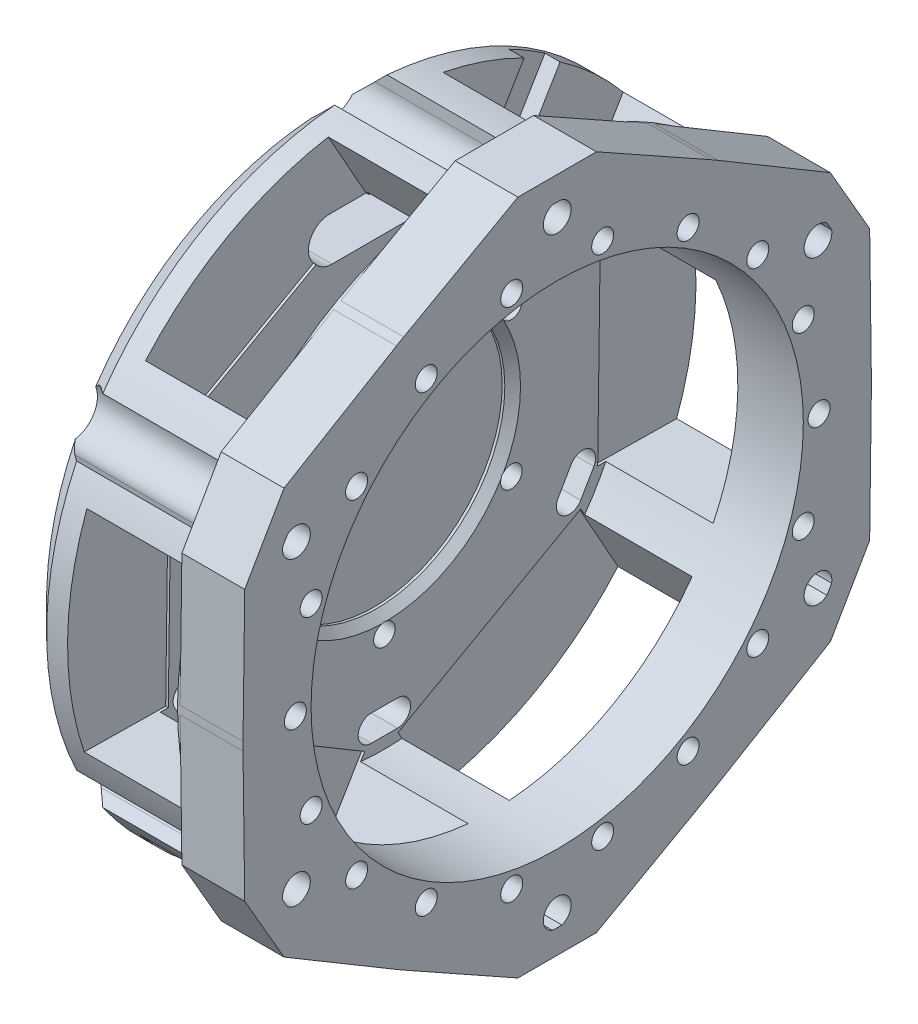
from build123d import *

# Parameters (mm, degrees)
CUT_EXTRUDE1_START      = -10
CUT_EXTRUDE1_OUTLINE_R  = 2.05
CUT_EXTRUDE1_DEPTH      = 10
CUT_EXTRUDE2_START      = -31
CUT_EXTRUDE2_DEPTH      = 31
SKETCH4_R               = 2.65
CUT_EXTRUDE3_DEPTH      = 96.126231924
SKETCH5_R               = 24.5
CUT_EXTRUDE4_DEPTH      = 2
BOSS_EXTRUDE1_DEPTH     = 12
SKETCH7_W               = 21
SKETCH7_H               = 40
CUT_EXTRUDE5_DEPTH      = 19
CIRPATTERN1_COUNT       = 6
CIRPATTERN2_DEPTH       = 10
CHAMFER2_SIZE           = 5.5
CHAMFER3_SIZE           = 1.5
SKETCH11_R              = 2.1
CUT_EXTRUDE7_DEPTH      = 5
SKETCH12_R              = 3.75
CUT_EXTRUDE8_DEPTH      = 5
CUT_EXTRUDE9_DEPTH      = 26
CUT_EXTRUDE9_DEPTH_BACK = 19
SKETCH13_W              = 4
SKETCH13_H              = 8


# Read off the part's stored shape, not the designer's step: Cut-Extrude1, CirPattern2
with BuildPart() as part:
    # Sketch1 → Revolve1 (revolve)
    with BuildSketch(Plane.XY, mode=Mode.PRIVATE) as revolve1_sk:
        Polygon((0, 0), (0, 60), (43, 60), (43, 47), (10, 47), (10, 0), align=None)
    revolve(revolve1_sk.sketch.rotate(Axis((-58.663171691, 0, 0), (1, 0, 0)), 90), axis=Axis((-58.663171691, 0, 0), (1, 0, 0)))

    # Cut-Extrude1 outline → Cut-Extrude1 (cut)
    with BuildSketch(Plane(origin=(10, 0, 0), x_dir=(0, 0, -1), z_dir=(1, 0, 0)).offset(CUT_EXTRUDE1_START)):
        with Locations((0, 28)):
            Circle(CUT_EXTRUDE1_OUTLINE_R)
        with Locations((-24.248711306, 14)):
            Circle(CUT_EXTRUDE1_OUTLINE_R)
        with Locations((-24.248711306, -14)):
            Circle(CUT_EXTRUDE1_OUTLINE_R)
        with Locations((0, -28)):
            Circle(CUT_EXTRUDE1_OUTLINE_R)
        with Locations((24.248711306, -14)):
            Circle(CUT_EXTRUDE1_OUTLINE_R)
        with Locations((24.248711306, 14)):
            Circle(CUT_EXTRUDE1_OUTLINE_R)
        with BuildLine():
            Line((10, 46.25), (-10, 46.25))
            ThreePointArc((-10, 46.25), (-14, 42.25), (-10, 38.25))
            Line((-10, 38.25), (10, 38.25))
            ThreePointArc((10, 38.25), (14, 42.25), (10, 46.25))
        make_face()
    extrude(amount=CUT_EXTRUDE1_DEPTH, mode=Mode.SUBTRACT)

    # Sketch3 → Cut-Extrude2 (cut)
    with BuildSketch(Plane.ZY.offset(CUT_EXTRUDE2_START)):
        with BuildLine():
            Line((-5, 57.5), (-5, 59.791303716))
            ThreePointArc((-5, 59.791303716), (0, 60), (5, 59.791303716))
            Line((5, 59.791303716), (5, 57.5))
            ThreePointArc((5, 57.5), (0, 52.5), (-5, 57.5))
        make_face()
        with BuildLine():
            Line((52.296460718, 24.419872981), (54.280787943, 25.565524839))
            ThreePointArc((54.280787943, 25.565524839), (51.961524227, 30), (49.280787943, 34.225778877))
            Line((49.280787943, 34.225778877), (47.296460718, 33.080127019))
            ThreePointArc((47.296460718, 33.080127019), (45.466333699, 26.25), (52.296460718, 24.419872981))
        make_face()
        with BuildLine():
            Line((47.296460718, -33.080127019), (49.280787943, -34.225778877))
            ThreePointArc((49.280787943, -34.225778877), (51.961524227, -30), (54.280787943, -25.565524839))
            Line((54.280787943, -25.565524839), (52.296460718, -24.419872981))
            ThreePointArc((52.296460718, -24.419872981), (45.466333699, -26.25), (47.296460718, -33.080127019))
        make_face()
        with BuildLine():
            Line((-5, -57.5), (-5, -59.791303716))
            ThreePointArc((-5, -59.791303716), (0, -60), (5, -59.791303716))
            Line((5, -59.791303716), (5, -57.5))
            ThreePointArc((5, -57.5), (0, -52.5), (-5, -57.5))
        make_face()
        with BuildLine():
            Line((-52.296460718, -24.419872981), (-54.280787943, -25.565524839))
            ThreePointArc((-54.280787943, -25.565524839), (-51.961524227, -30), (-49.280787943, -34.225778877))
            Line((-49.280787943, -34.225778877), (-47.296460718, -33.080127019))
            ThreePointArc((-47.296460718, -33.080127019), (-45.466333699, -26.25), (-52.296460718, -24.419872981))
        make_face()
        with BuildLine():
            Line((-47.296460718, 33.080127019), (-49.280787943, 34.225778877))
            ThreePointArc((-49.280787943, 34.225778877), (-51.961524227, 30), (-54.280787943, 25.565524839))
            Line((-54.280787943, 25.565524839), (-52.296460718, 24.419872981))
            ThreePointArc((-52.296460718, 24.419872981), (-45.466333699, 26.25), (-47.296460718, 33.080127019))
        make_face()
    extrude(amount=CUT_EXTRUDE2_DEPTH, mode=Mode.SUBTRACT)

    # Sketch4 → Cut-Extrude3 (cut, through all)
    with BuildSketch(Plane.ZY):
        with Locations((0, 57.5)):
            Circle(SKETCH4_R)
        with Locations((49.796460718, 28.75)):
            Circle(SKETCH4_R)
        with Locations((49.796460718, -28.75)):
            Circle(SKETCH4_R)
        with Locations((0, -57.5)):
            Circle(SKETCH4_R)
        with Locations((-49.796460718, -28.75)):
            Circle(SKETCH4_R)
        with Locations((-49.796460718, 28.75)):
            Circle(SKETCH4_R)
    extrude(amount=-CUT_EXTRUDE3_DEPTH, mode=Mode.SUBTRACT)

    # Sketch5 → Cut-Extrude4 (cut)
    with BuildSketch(Plane(origin=(10, 0, 0), x_dir=(0, 0, -1), z_dir=(1, 0, 0))):
        Circle(SKETCH5_R)
    extrude(amount=-CUT_EXTRUDE4_DEPTH, mode=Mode.SUBTRACT)

    # Sketch6 → Boss-Extrude1 (add)
    with BuildSketch(Plane(origin=(43, 0, 0), x_dir=(0, 0, -1), z_dir=(1, 0, 0))):
        with BuildLine():
            Line((-29.313322314, 52.351973553), (-7.5, 64.565857851))
            Line((-7.5, 64.565857851), (7.5, 64.565857851))
            Line((7.5, 64.565857851), (29.313322314, 52.351973553))
            ThreePointArc((29.313322314, 52.351973553), (0, 60), (-29.313322314, 52.351973553))
        make_face()
        with BuildLine():
            Line((59.665673116, 25.787738397), (59.994800192, 0.789904984))
            ThreePointArc((59.994800192, 0.789904984), (51.961524227, 30), (30.681477878, 51.56206857))
            Line((30.681477878, 51.56206857), (52.165673116, 38.778119454))
            Line((52.165673116, 38.778119454), (59.665673116, 25.787738397))
        make_face()
        with BuildLine():
            Line((52.165673116, -38.778119454), (30.681477878, -51.56206857))
            ThreePointArc((30.681477878, -51.56206857), (51.961524227, -30), (59.994800192, -0.789904984))
            Line((59.994800192, -0.789904984), (59.665673116, -25.787738397))
            Line((59.665673116, -25.787738397), (52.165673116, -38.778119454))
        make_face()
        with BuildLine():
            Line((-7.5, -64.565857851), (-29.313322314, -52.351973553))
            ThreePointArc((-29.313322314, -52.351973553), (0, -60), (29.313322314, -52.351973553))
            Line((29.313322314, -52.351973553), (7.5, -64.565857851))
            Line((7.5, -64.565857851), (-7.5, -64.565857851))
        make_face()
        with BuildLine():
            Line((-59.665673116, -25.787738397), (-59.994800192, -0.789904984))
            ThreePointArc((-59.994800192, -0.789904984), (-51.961524227, -30), (-30.681477878, -51.56206857))
            Line((-30.681477878, -51.56206857), (-52.165673116, -38.778119454))
            Line((-52.165673116, -38.778119454), (-59.665673116, -25.787738397))
        make_face()
        with BuildLine():
            Line((-52.165673116, 38.778119454), (-30.681477878, 51.56206857))
            ThreePointArc((-30.681477878, 51.56206857), (-51.961524227, 30), (-59.994800192, 0.789904984))
            Line((-59.994800192, 0.789904984), (-59.665673116, 25.787738397))
            Line((-59.665673116, 25.787738397), (-52.165673116, 38.778119454))
        make_face()
    extrude(amount=-BOSS_EXTRUDE1_DEPTH)

    # Sketch7 → Cut-Extrude5 (cut)
    with BuildSketch(Plane(origin=(0, 52.351973553, 29.313322314), x_dir=(1, 0, 0), z_dir=(0, 0.8725328925546713, 0.4885553718977804))):
        with Locations((20, -0.027920324)):
            Rectangle(SKETCH7_W, SKETCH7_H)
    cut_extrude5 = extrude(amount=-CUT_EXTRUDE5_DEPTH, mode=Mode.SUBTRACT)

    # CirPattern1: Cut-Extrude5 ×6 about axis
    cirpattern1_axis = Axis((0, 0, 0), (1, 0, 0))
    for i in range(1, CIRPATTERN1_COUNT):
        add(cut_extrude5.rotate(cirpattern1_axis, i * 360 / CIRPATTERN1_COUNT), mode=Mode.SUBTRACT)

    # CirPattern2 outline → CirPattern2 (cut)
    with BuildSketch(Plane.YZ):
        with BuildLine():
            Line((24.540063509, 37.504636819), (20.209936491, 40.004636819))
            ThreePointArc((20.209936491, 40.004636819), (16.794872981, 39.08957331), (17.709936491, 35.6745098))
            Line((17.709936491, 35.6745098), (22.040063509, 33.1745098))
            ThreePointArc((22.040063509, 33.1745098), (25.455127019, 34.089573309), (24.540063509, 37.504636819))
        make_face()
        with BuildLine():
            Line((-24.540063509, -37.504636819), (-20.209936491, -40.004636819))
            ThreePointArc((-20.209936491, -40.004636819), (-16.794872981, -39.08957331), (-17.709936491, -35.6745098))
            Line((-17.709936491, -35.6745098), (-22.040063509, -33.1745098))
            ThreePointArc((-22.040063509, -33.1745098), (-25.455127019, -34.089573309), (-24.540063509, -37.504636819))
        make_face()
        with BuildLine():
            Line((20.209936491, -40.004636819), (24.540063509, -37.504636819))
            ThreePointArc((24.540063509, -37.504636819), (25.455127019, -34.089573309), (22.040063509, -33.1745098))
            Line((22.040063509, -33.1745098), (17.709936491, -35.6745098))
            ThreePointArc((17.709936491, -35.6745098), (16.794872981, -39.08957331), (20.209936491, -40.004636819))
        make_face()
        with BuildLine():
            Line((-20.209936491, 40.004636819), (-24.540063509, 37.504636819))
            ThreePointArc((-24.540063509, 37.504636819), (-25.455127019, 34.089573309), (-22.040063509, 33.1745098))
            Line((-22.040063509, 33.1745098), (-17.709936491, 35.6745098))
            ThreePointArc((-17.709936491, 35.6745098), (-16.794872981, 39.08957331), (-20.209936491, 40.004636819))
        make_face()
        with BuildLine():
            Line((-44.75, 2.5), (-44.75, -2.5))
            ThreePointArc((-44.75, -2.5), (-42.25, -5), (-39.75, -2.5))
            Line((-39.75, -2.5), (-39.75, 2.5))
            ThreePointArc((-39.75, 2.5), (-42.25, 5), (-44.75, 2.5))
        make_face()
    extrude(amount=CIRPATTERN2_DEPTH, mode=Mode.SUBTRACT)

    # Chamfer2
    chamfer2_edges = [part.edges().sort_by_distance(p)[0] for p in [
        (0, 51.961524227, -30),
        (0, 0, -60),
        (0, 51.961524227, 30),
        (0, 0, 60),
        (0, -51.961524227, 30),
        (0, -51.961524227, -30),
    ]]
    chamfer(chamfer2_edges, length=CHAMFER2_SIZE)

    # Chamfer3
    # the kernel refuses this chamfer: 1.5 mm, written as the material it takes off along each edge
    with BuildSketch(Plane(origin=(10, 0, 0), x_dir=(0, 0, -1), z_dir=(0, -1, 0))) as chamfer3_piece_1:
        Polygon((24.5 + CHAMFER3_SIZE, 0), (24.5, -CHAMFER3_SIZE), (24.5, 0), align=None)
    revolve(axis=Axis((10, 0, 0), (1, 0, 0)), mode=Mode.SUBTRACT)

    # Sketch11 → Cut-Extrude7 (cut)
    with BuildSketch(Plane(origin=(43, 0, 0), x_dir=(0, 0, -1), z_dir=(1, 0, 0))):
        with Locations((-38.302222156, 32.139380484)):
            Circle(SKETCH11_R)
        with Locations((-46.984631039, 17.101007166)):
            Circle(SKETCH11_R)
        with Locations((-25, 43.301270189)):
            Circle(SKETCH11_R)
        with Locations((-8.682408883, 49.240387651)):
            Circle(SKETCH11_R)
        with Locations((8.682408883, 49.240387651)):
            Circle(SKETCH11_R)
        with Locations((25, 43.301270189)):
            Circle(SKETCH11_R)
        with Locations((38.302222156, 32.139380484)):
            Circle(SKETCH11_R)
        with Locations((46.984631039, 17.101007166)):
            Circle(SKETCH11_R)
        with Locations((46.984631039, -17.101007166)):
            Circle(SKETCH11_R)
        with Locations((50, 0)):
            Circle(SKETCH11_R)
        with Locations((38.302222156, -32.139380484)):
            Circle(SKETCH11_R)
        with Locations((25, -43.301270189)):
            Circle(SKETCH11_R)
        with Locations((-50, 0)):
            Circle(SKETCH11_R)
        with Locations((-46.984631039, -17.101007166)):
            Circle(SKETCH11_R)
        with Locations((-38.302222156, -32.139380484)):
            Circle(SKETCH11_R)
        with Locations((-25, -43.301270189)):
            Circle(SKETCH11_R)
        with Locations((-8.682408883, -49.240387651)):
            Circle(SKETCH11_R)
        with Locations((8.682408883, -49.240387651)):
            Circle(SKETCH11_R)
    extrude(amount=-CUT_EXTRUDE7_DEPTH, mode=Mode.SUBTRACT)

    # Sketch12 → Cut-Extrude8 (cut)
    with BuildSketch(Plane.ZY):
        with Locations((0, 28)):
            Circle(SKETCH12_R)
        with Locations((24.248711306, 14)):
            Circle(SKETCH12_R)
        with Locations((24.248711306, -14)):
            Circle(SKETCH12_R)
        with Locations((0, -28)):
            Circle(SKETCH12_R)
        with Locations((-24.248711306, -14)):
            Circle(SKETCH12_R)
        with Locations((-24.248711306, 14)):
            Circle(SKETCH12_R)
    extrude(amount=-CUT_EXTRUDE8_DEPTH, mode=Mode.SUBTRACT)

    # Sketch13 → Cut-Extrude9 (cut, two sides: drawn at the far end of the back side and taken through both)
    with BuildSketch(Plane(origin=(0, 35.234080189, -20.96567655), x_dir=(1, 0, 0), z_dir=(0, 0.8593678094961662, -0.5113579646409753)).offset(-CUT_EXTRUDE9_DEPTH_BACK)):
        with Locations((8.6, 0)):
            Rectangle(SKETCH13_W, SKETCH13_H)
    extrude(amount=CUT_EXTRUDE9_DEPTH + CUT_EXTRUDE9_DEPTH_BACK, mode=Mode.SUBTRACT)


solid = part.part
